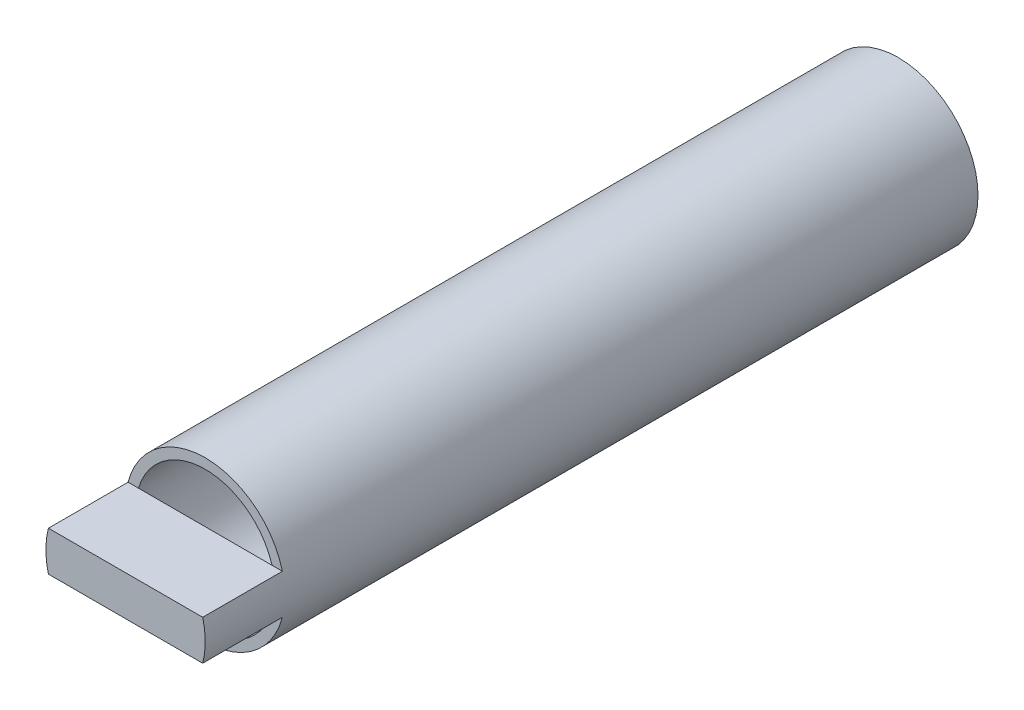
from build123d import *
from build123d.topology import SkipClean

# Parameters (mm, degrees)
SKETCH1_R           = 10
SKETCH1_R_2         = 8.75
BOSS_EXTRUDE1_DEPTH = 43.5
BOSS_EXTRUDE2_START = 10
BOSS_EXTRUDE2_DEPTH = 10


with BuildPart() as part:
    # Sketch1 → Boss-Extrude1 (new, symmetric)
    with BuildSketch(Plane.XY):
        Circle(SKETCH1_R)
        Circle(SKETCH1_R_2, mode=Mode.SUBTRACT)
    extrude(amount=BOSS_EXTRUDE1_DEPTH, both=True)

    # Sketch2 → Boss-Extrude2 (add)
    with SkipClean():  # the faces are left unmerged after this step: merging them gives an invalid solid
        with BuildSketch(Plane.XY.offset(43.5).offset(BOSS_EXTRUDE2_START)):
            with BuildLine():
                Line((9.682458366, -2.5), (-9.682458366, -2.5))
                ThreePointArc((-9.682458366, -2.5), (-10, 0), (-9.682458366, 2.5))
                Line((-9.682458366, 2.5), (9.682458366, 2.5))
                ThreePointArc((9.682458366, 2.5), (10, 0), (9.682458366, -2.5))
            make_face()
        extrude(amount=-BOSS_EXTRUDE2_DEPTH)


solid = part.part
